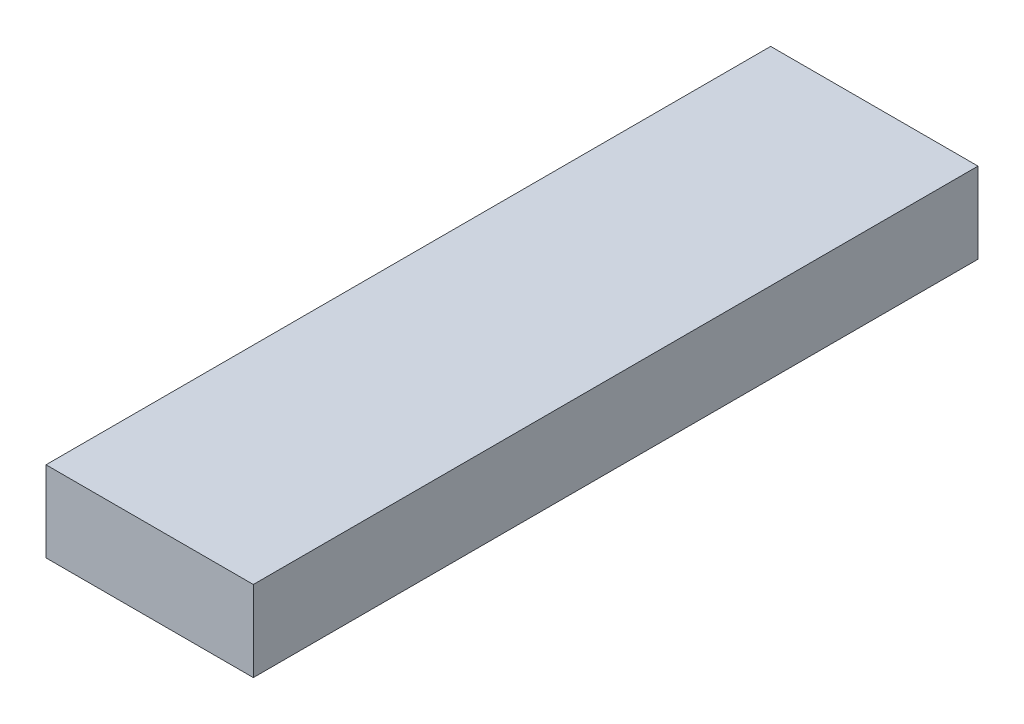
from build123d import *

# Parameters (mm, degrees)
SKETCH1_W           = 72.674083076
SKETCH1_H           = 28.271195995
BOSS_EXTRUDE1_DEPTH = 254


with BuildPart() as part:
    # Sketch1 → Boss-Extrude1 (new body)
    with BuildSketch(Plane.XY):
        with Locations((36.337041538, 14.135597998)):
            Rectangle(SKETCH1_W, SKETCH1_H)
    extrude(amount=BOSS_EXTRUDE1_DEPTH)


solid = part.part
